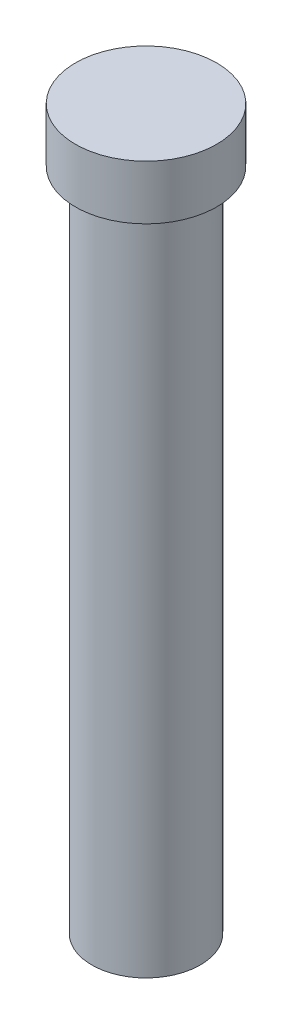
from build123d import *


with BuildPart() as part:
    # Sketch1 → Revolve1 (revolve)
    with BuildSketch(Plane.XY):
        Polygon((0, 0), (6.5, 0), (6.5, -5), (5, -5), (5, -66.2), (0, -66.2), align=None)
    revolve(axis=Axis((0, -71.2, 0), (0, 1, 0)))


solid = part.part
